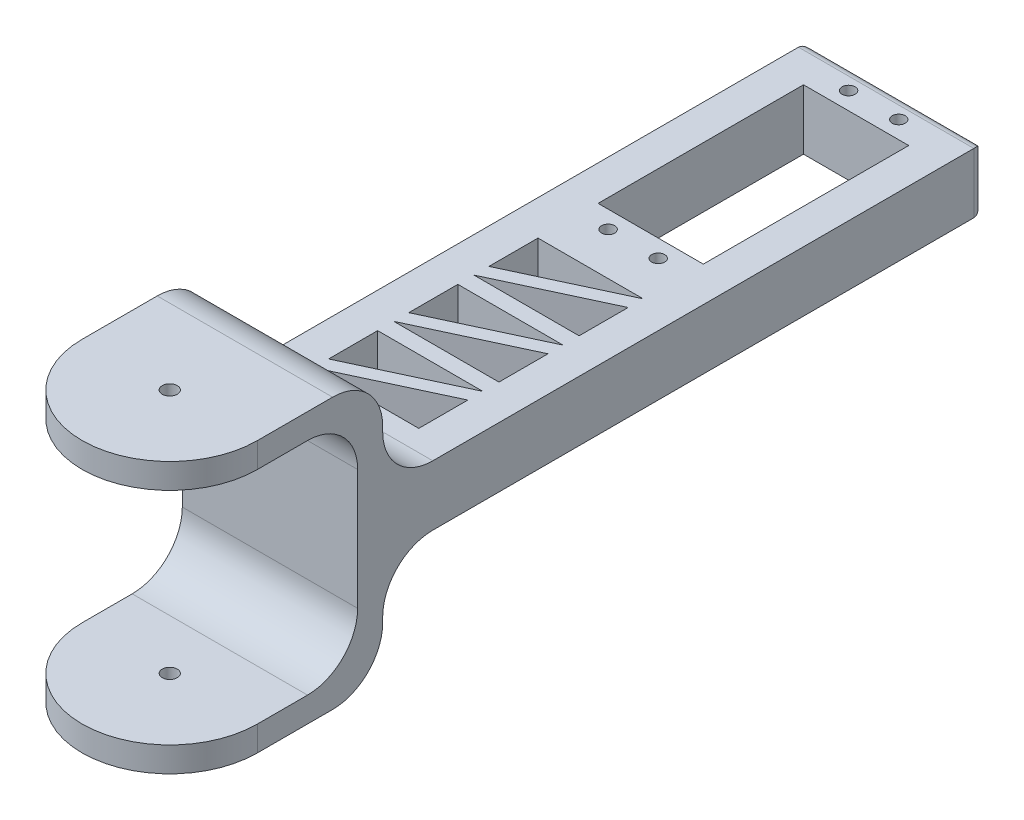
from build123d import *

# Parameters (mm, degrees)
SKETCH1_R           = 1.5
BOSS_EXTRUDE1_DEPTH = 5
SKETCH3_R           = 1.5
BOSS_EXTRUDE2_DEPTH = 5
SKETCH4_W           = 35
SKETCH4_H           = 54
BOSS_EXTRUDE3_DEPTH = 5
FILLET1_R           = 10
SKETCH6_W           = 35
SKETCH6_H           = 12
BOSS_EXTRUDE4_DEPTH = 120
CUT_EXTRUDE1_REACH  = 151.734
SKETCH7_R           = 1.3
SKETCH7_W           = 21
SKETCH7_H           = 41
CUT_EXTRUDE2_REACH  = 151.734
LPATTERN1_COUNT     = 3
LPATTERN1_PITCH     = 16
FILLET2_R           = 10
FILLET3_R           = 2


with BuildPart() as part:
    # Sketch1 → Boss-Extrude1 (new body)
    with BuildSketch(Plane(origin=(0, 0, 0), x_dir=(1, 0, 0), z_dir=(0, 1, 0))):
        with BuildLine():
            Line((-17.5, 20), (-17.5, 0))
            ThreePointArc((-17.5, 0), (0, -17.5), (17.5, 0))
            Line((17.5, 0), (17.5, 20))
            Line((17.5, 20), (-17.5, 20))
        make_face()
        Circle(SKETCH1_R, mode=Mode.SUBTRACT)
    extrude(amount=BOSS_EXTRUDE1_DEPTH)



with BuildPart() as body_2:
    # Sketch3 → Boss-Extrude2 (new body)
    with BuildSketch(Plane(origin=(0, -49, 0), x_dir=(1, 0, 0), z_dir=(0, 1, 0))):
        with BuildLine():
            Line((17.5, 0), (17.5, 20))
            Line((17.5, 20), (-17.5, 20))
            Line((-17.5, 20), (-17.5, 0))
            ThreePointArc((-17.5, 0), (0, -17.5), (17.5, 0))
        make_face()
        Circle(SKETCH3_R, mode=Mode.SUBTRACT)
    extrude(amount=BOSS_EXTRUDE2_DEPTH)


with BuildPart() as part_1:
    add(part.part)

    add(body_2.part)  # Boss-Extrude3 merges body 2
    # Sketch4 → Boss-Extrude3 (add)
    with BuildSketch(Plane(origin=(0, 0, -20), x_dir=(-1, 0, 0), z_dir=(0, 0, -1))):
        with Locations((0, -22)):
            Rectangle(SKETCH4_W, SKETCH4_H)
    extrude(amount=BOSS_EXTRUDE3_DEPTH)

    # Fillet1
    fillet1_edges = [part_1.edges().sort_by_distance(p)[0] for p in [
        (0, -49, -25),
        (0, 5, -25),
        (0, -44, -20),
        (0, 0, -20),
    ]]
    fillet(fillet1_edges, radius=FILLET1_R)

    # Sketch6 → Boss-Extrude4 (add)
    with BuildSketch(Plane(origin=(0, 0, -25), x_dir=(-1, 0, 0), z_dir=(0, 0, -1))):
        with Locations((0, -22)):
            Rectangle(SKETCH6_W, SKETCH6_H)
    extrude(amount=BOSS_EXTRUDE4_DEPTH)

    # Sketch7 → Cut-Extrude1 (cut, up to next)
    with BuildSketch(Plane(origin=(0, -16, 0), x_dir=(1, 0, 0), z_dir=(0, 1, 0)), mode=Mode.PRIVATE) as cut_extrude1_sk1:
        with Locations((-5, 140.5)):
            Circle(SKETCH7_R)
    cut_extrude1_tool1 = extrude(cut_extrude1_sk1.sketch, amount=-CUT_EXTRUDE1_REACH, mode=Mode.PRIVATE) & part_1.part
    # Sketch7 → Cut-Extrude1 (cut, up to next)
    with BuildSketch(Plane(origin=(0, -16, 0), x_dir=(1, 0, 0), z_dir=(0, 1, 0)), mode=Mode.PRIVATE) as cut_extrude1_sk2:
        with Locations((5, 140.5)):
            Circle(SKETCH7_R)
    cut_extrude1_tool2 = extrude(cut_extrude1_sk2.sketch, amount=-CUT_EXTRUDE1_REACH, mode=Mode.PRIVATE) & part_1.part
    # Sketch7 → Cut-Extrude1 (cut, up to next)
    with BuildSketch(Plane(origin=(0, -16, 0), x_dir=(1, 0, 0), z_dir=(0, 1, 0)), mode=Mode.PRIVATE) as cut_extrude1_sk3:
        with Locations((5, 92.5)):
            Circle(SKETCH7_R)
    cut_extrude1_tool3 = extrude(cut_extrude1_sk3.sketch, amount=-CUT_EXTRUDE1_REACH, mode=Mode.PRIVATE) & part_1.part
    # Sketch7 → Cut-Extrude1 (cut, up to next)
    with BuildSketch(Plane(origin=(0, -16, 0), x_dir=(1, 0, 0), z_dir=(0, 1, 0)), mode=Mode.PRIVATE) as cut_extrude1_sk4:
        with Locations((-5, 92.5)):
            Circle(SKETCH7_R)
    cut_extrude1_tool4 = extrude(cut_extrude1_sk4.sketch, amount=-CUT_EXTRUDE1_REACH, mode=Mode.PRIVATE) & part_1.part
    # Sketch7 → Cut-Extrude1 (cut, up to next)
    with BuildSketch(Plane(origin=(0, -16, 0), x_dir=(1, 0, 0), z_dir=(0, 1, 0)), mode=Mode.PRIVATE) as cut_extrude1_sk5:
        with Locations((0, 116.5)):
            Rectangle(SKETCH7_W, SKETCH7_H)
    cut_extrude1_tool5 = extrude(cut_extrude1_sk5.sketch, amount=-CUT_EXTRUDE1_REACH, mode=Mode.PRIVATE) & part_1.part
    add(cut_extrude1_tool1.solids().sort_by_distance((-5, -16, -140.5))[0], mode=Mode.SUBTRACT)
    add(cut_extrude1_tool2.solids().sort_by_distance((5, -16, -140.5))[0], mode=Mode.SUBTRACT)
    add(cut_extrude1_tool3.solids().sort_by_distance((5, -16, -92.5))[0], mode=Mode.SUBTRACT)
    add(cut_extrude1_tool4.solids().sort_by_distance((-5, -16, -92.5))[0], mode=Mode.SUBTRACT)
    add(cut_extrude1_tool5.solids().sort_by_distance((0, -16, -116.5))[0], mode=Mode.SUBTRACT)

    # Sketch8 → Cut-Extrude2 (cut, up to next)
    with BuildSketch(Plane(origin=(0, -16, 0), x_dir=(1, 0, 0), z_dir=(0, 1, 0)), mode=Mode.PRIVATE) as cut_extrude2_sk1:
        Polygon((10.5, 84), (-10.5, 84), (-10.5, 74.207539179), align=None)
    cut_extrude2_tool1 = extrude(cut_extrude2_sk1.sketch, amount=-CUT_EXTRUDE2_REACH, mode=Mode.PRIVATE) & part_1.part
    # Sketch8 → Cut-Extrude2 (cut, up to next)
    with BuildSketch(Plane(origin=(0, -16, 0), x_dir=(1, 0, 0), z_dir=(0, 1, 0)), mode=Mode.PRIVATE) as cut_extrude2_sk2:
        Polygon((10.5, 71.207539179), (10.5, 81), (-10.5, 71.207539179), align=None)
    cut_extrude2_tool2 = extrude(cut_extrude2_sk2.sketch, amount=-CUT_EXTRUDE2_REACH, mode=Mode.PRIVATE) & part_1.part
    cut_extrude2_1 = cut_extrude2_tool1.solids().sort_by_distance((-3.5, -16, -80.735846))[0]
    add(cut_extrude2_1, mode=Mode.SUBTRACT)
    cut_extrude2_2 = cut_extrude2_tool2.solids().sort_by_distance((3.5, -16, -74.471693))[0]
    add(cut_extrude2_2, mode=Mode.SUBTRACT)
    cut_extrude2 = cut_extrude2_1 + cut_extrude2_2  # Cut-Extrude2 as one shape, for the pattern or mirror that repeats it

    # LPattern1: Cut-Extrude2 ×3
    with Locations(*[(0, 0, i * LPATTERN1_PITCH) for i in range(1, LPATTERN1_COUNT)]):
        add(cut_extrude2, mode=Mode.SUBTRACT)

    # Fillet2
    fillet2_edges = [part_1.edges().sort_by_distance(p)[0] for p in [
        (0, -16, -25),
        (0, -28, -25),
    ]]
    fillet(fillet2_edges, radius=FILLET2_R)

    # Fillet3
    fillet3_edges = [part_1.edges().sort_by_distance(p)[0] for p in [
        (17.5, -22, -145),
        (-17.5, -22, -145),
        (0, -16, -145),
        (0, -28, -145),
    ]]
    fillet(fillet3_edges, radius=FILLET3_R)


solid = part_1.part
